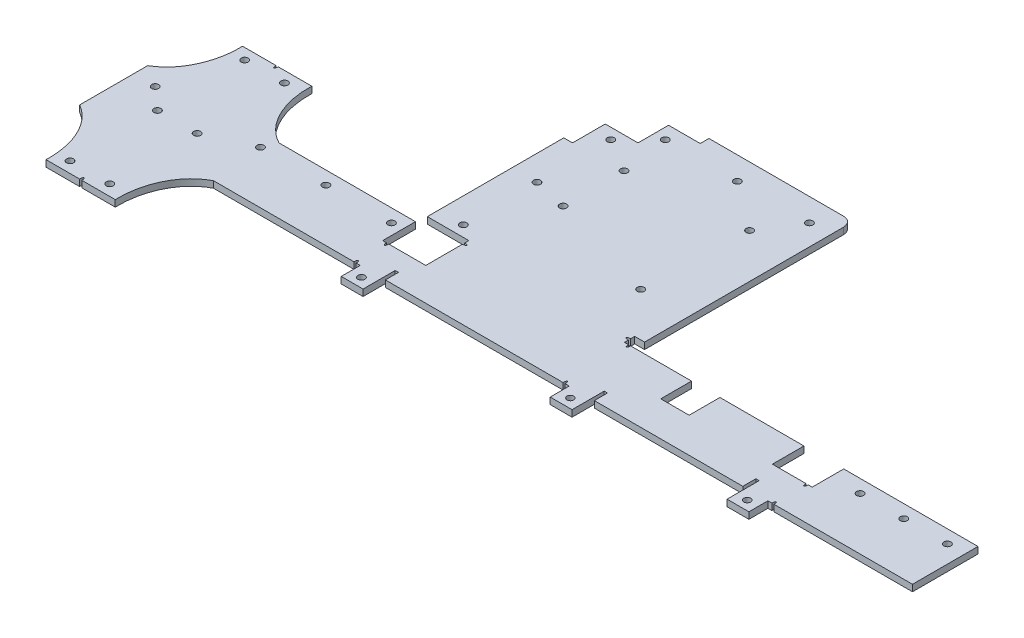
from build123d import *

# Parameters (mm, degrees)
SKETCH1_W                   = 100
SKETCH1_H                   = 100
BOSS_EXTRUDE1_DEPTH         = 30
BOSS_EXTRUDE3_DEPTH         = 30
CUT_EXTRUDE6_DEPTH          = 30
CUT_EXTRUDE7_DEPTH          = 30
CUT_EXTRUDE8_DEPTH          = 27
SHARPBEND4_START            = -30
SHARPBEND4_DEPTH            = 90
SHARPBEND4_START_2          = 3
SHARPBEND4_2_DEPTH          = 27
SHARPBEND4_3_DEPTH          = 90
EDGE_FLANGE1_DEPTH          = 91
SKETCH23_W                  = 14.447953321
SKETCH23_H                  = 15.392934238
CUT_EXTRUDE9_DEPTH          = 27
CUT_EXTRUDE10_START         = -4.5
CUT_EXTRUDE10_OUTLINE_W     = 19
CUT_EXTRUDE10_OUTLINE_H     = 14.446778047
CUT_EXTRUDE10_DEPTH         = 4.5
CUT_EXTRUDE11_START         = -4.5
CUT_EXTRUDE11_DEPTH         = 4.5
EDGE_FLANGE2_START          = 84
EDGE_FLANGE2_DEPTH          = 11.5
EDGE_FLANGE2_2_DEPTH        = 1.5
EDGE_FLANGE2_START_2        = 85.5
EDGE_FLANGE2_3_DEPTH        = 10
EDGE_FLANGE3_START          = 4.5
EDGE_FLANGE3_DEPTH          = 11.5
EDGE_FLANGE3_START_2        = 14.5
EDGE_FLANGE3_2_DEPTH        = 1.5
EDGE_FLANGE3_3_DEPTH        = 10
EDGE_FLANGE5_START          = 4.5
EDGE_FLANGE5_DEPTH          = 11.5
EDGE_FLANGE5_START_2        = 14.5
EDGE_FLANGE5_2_DEPTH        = 1.5
EDGE_FLANGE5_3_DEPTH        = 10
SKETCH44_R                  = 1.55
CUT_EXTRUDE12_DEPTH         = 3
SKETCH46_R                  = 1.6
CUT_EXTRUDE13_DEPTH         = 10
SKETCH47_R                  = 1.6
CUT_EXTRUDE14_DEPTH         = 10
SKETCH48_R                  = 1.6
CUT_EXTRUDE15_DEPTH         = 10
SKETCH49_R                  = 1.6
CUT_EXTRUDE16_DEPTH         = 10
SKETCH50_R                  = 1.6
CUT_EXTRUDE17_DEPTH         = 10
SKETCH51_R                  = 1.6
CUT_EXTRUDE18_DEPTH         = 10
SKETCH52_W                  = 13
SKETCH52_H                  = 11.5
CUT_EXTRUDE19_DEPTH         = 10
SKETCH59_W                  = 3
SKETCH59_H                  = 66
BOSS_EXTRUDE4_DEPTH         = 4
SKETCH56_W                  = 91.5
SKETCH56_H                  = 3
BOSS_EXTRUDE5_DEPTH         = 4.5
SKETCH53_W                  = 62.5
SKETCH53_H                  = 3
BOSS_EXTRUDE6_DEPTH         = 4
CUT_EXTRUDE21_DEPTH         = 10
CUT_EXTRUDE22_OUTLINE_R     = 1.6
CUT_EXTRUDE22_OUTLINE_R_2   = 1.55
CUT_EXTRUDE22_OUTLINE_W     = 13
CUT_EXTRUDE22_OUTLINE_H     = 11.5
CUT_EXTRUDE22_DEPTH         = 97
CUT_EXTRUDE22_START         = -2.5
CUT_EXTRUDE22_2_OUTLINE_W   = 62.5
CUT_EXTRUDE22_2_OUTLINE_H   = 3
CUT_EXTRUDE22_2_DEPTH       = 2.5
CUT_EXTRUDE22_START_2       = -3
CUT_EXTRUDE22_3_OUTLINE_R   = 1.6
CUT_EXTRUDE22_3_OUTLINE_R_2 = 1.55
CUT_EXTRUDE22_3_OUTLINE_W   = 10
CUT_EXTRUDE22_3_OUTLINE_H   = 3
CUT_EXTRUDE22_3_DEPTH       = 3
SKETCH68_RX                 = 1.5
SKETCH68_RY                 = 0.5
CUT_EXTRUDE23_DEPTH         = 10


with BuildPart() as part:
    # Sketch1 → Boss-Extrude1 (new body)
    with BuildSketch(Plane.XY):
        with Locations((50, 50)):
            Rectangle(SKETCH1_W, SKETCH1_H)
    extrude(amount=BOSS_EXTRUDE1_DEPTH)

    # Sketch5 → Boss-Extrude3 (add)
    with BuildSketch(Plane(origin=(0, 0, 0), x_dir=(-1, 0, 0), z_dir=(0, 0, -1))):
        Polygon((0, 33), (-3, 33), (-3, 3), (-33, 3), (-33, 0), (-3, 0), (0, 0), (0, 3), align=None)
    boss_extrude3 = extrude(amount=BOSS_EXTRUDE3_DEPTH)

    # Sketch9 → Cut-Extrude6 (cut)
    with BuildSketch(Plane(origin=(3, 0, 0), x_dir=(0, 0, -1), z_dir=(1, 0, 0))):
        with BuildLine():
            Line((30, 33), (30, 18))
            add(Edge.make_bspline(
                [(30, 18), (18.509534106, 17.590344289), (5.628092771, 22.225813209), (0, 33)],
                knots=[0, 0, 0, 0, 1, 1, 1, 1], degree=3))
            Line((0, 33), (30, 33))
        make_face()
    cut_extrude6 = extrude(amount=-CUT_EXTRUDE6_DEPTH, mode=Mode.SUBTRACT)

    # Sketch8 → Cut-Extrude7 (cut)
    with BuildSketch(Plane(origin=(0, 3, 0), x_dir=(1, 0, 0), z_dir=(0, 1, 0))):
        with BuildLine():
            Line((18, 30), (33, 30))
            Line((33, 30), (33, 0))
            add(Edge.make_bspline(
                [(18, 30), (17.590344289, 18.509534106), (22.225813209, 5.628092771), (33, 0)],
                knots=[0, 0, 0, 0, 1, 1, 1, 1], degree=3))
        make_face()
    cut_extrude7 = extrude(amount=-CUT_EXTRUDE7_DEPTH, mode=Mode.SUBTRACT)

    # Mirror2: Boss-Extrude3, Cut-Extrude6, Cut-Extrude7 across plane
    add(boss_extrude3.mirror(Plane(origin=(0, 0, 15), x_dir=(1, 0, 0), z_dir=(0, 0, -1))))
    add(cut_extrude6.mirror(Plane(origin=(0, 0, 15), x_dir=(1, 0, 0), z_dir=(0, 0, -1))), mode=Mode.SUBTRACT)
    add(cut_extrude7.mirror(Plane(origin=(0, 0, 15), x_dir=(1, 0, 0), z_dir=(0, 0, -1))), mode=Mode.SUBTRACT)

    # Sketch17 → Cut-Extrude8 (cut)
    with BuildSketch(Plane.XY.offset(30)):
        Polygon((3, 36), (3, 3), (36, 3), (97, 3), (97, 97), (3, 97), align=None)
    extrude(amount=-CUT_EXTRUDE8_DEPTH, mode=Mode.SUBTRACT)

    # SharpBend4: read off the stored shape, not the designer's step
    # SharpBend4 outline → SharpBend4 (cut)
    with BuildSketch(Plane.XY.offset(SHARPBEND4_START)):
        with BuildLine():
            Line((3, 95.5), (3, 34))
            Line((3, 34), (0, 34))
            Line((0, 34), (0, 32.000000005))
            Line((0, 32.000000005), (3, 32))
            Line((3, 32), (3, 4.5))
            ThreePointArc((3, 4.5), (3.439339828, 3.439339828), (4.5, 3))
            Line((4.5, 3), (95.5, 3))
            ThreePointArc((95.5, 3), (96.560660172, 3.439339828), (97, 4.5))
            Line((97, 4.5), (97, 95.5))
            ThreePointArc((97, 95.5), (96.560660172, 96.560660172), (95.5, 97))
            Line((95.5, 97), (4.5, 97))
            ThreePointArc((4.5, 97), (3.439339828, 96.560660172), (3, 95.5))
        make_face()
        with BuildLine():
            ThreePointArc((4.5, 0), (1.318019485, 1.318019485), (0, 4.5))
            Line((0, 4.5), (0, 0))
            Line((0, 0), (4.5, 0))
        make_face()
        with BuildLine():
            Line((0, 100), (0, 95.5))
            ThreePointArc((0, 95.5), (1.318019485, 98.681980515), (4.5, 100))
            Line((4.5, 100), (0, 100))
        make_face()
        with BuildLine():
            ThreePointArc((100, 4.5), (98.681980515, 1.318019485), (95.5, 0))
            Line((95.5, 0), (100, 0))
            Line((100, 0), (100, 4.5))
        make_face()
        with BuildLine():
            Line((100, 100), (95.5, 100))
            ThreePointArc((95.5, 100), (98.681980515, 98.681980515), (100, 95.5))
            Line((100, 95.5), (100, 100))
        make_face()
    extrude(amount=SHARPBEND4_DEPTH, mode=Mode.SUBTRACT)

    # SharpBend4 2 outline → SharpBend4 2 (add)
    with BuildSketch(Plane.XY.offset(SHARPBEND4_START_2)):
        with BuildLine():
            ThreePointArc((4.5, 3), (3.439339828, 3.439339828), (3, 4.5))
            Line((3, 4.5), (3, 3))
            Line((3, 3), (4.5, 3))
        make_face()
        with BuildLine():
            Line((3, 97), (3, 95.5))
            ThreePointArc((3, 95.5), (3.439339828, 96.560660172), (4.5, 97))
            Line((4.5, 97), (3, 97))
        make_face()
        with BuildLine():
            ThreePointArc((97, 4.5), (96.560660172, 3.439339828), (95.5, 3))
            Line((95.5, 3), (97, 3))
            Line((97, 3), (97, 4.5))
        make_face()
        with BuildLine():
            Line((97, 97), (95.5, 97))
            ThreePointArc((95.5, 97), (96.560660172, 96.560660172), (97, 95.5))
            Line((97, 95.5), (97, 97))
        make_face()
    extrude(amount=SHARPBEND4_2_DEPTH)

    # SharpBend4 3 outline → SharpBend4 3 (add)
    with BuildSketch(Plane.XY.offset(SHARPBEND4_START)):
        with BuildLine():
            ThreePointArc((4.5, 3), (3.439339828, 3.439339828), (3, 4.5))
            Line((3, 4.5), (3, 3))
            Line((3, 3), (4.5, 3))
        make_face()
    extrude(amount=SHARPBEND4_3_DEPTH)

    # Edge-Flange1: sheet metal written as solids
    # Edge-Flange1 section (on a plane across the edge) → Edge-Flange1 (add)
    with BuildSketch(Plane(origin=(97, 95.5, -1.5), x_dir=(0, 0, 1), z_dir=(0, -1, 0))):
        with BuildLine():
            Line((-3, 1.5), (-3, 93))
            Line((-3, 93), (0, 93))
            Line((0, 93), (0, 1.5))
            ThreePointArc((0, 1.5), (0.439339828, 0.439339828), (1.5, 0))
            Line((1.5, 0), (1.5, -3))
            ThreePointArc((1.5, -3), (-1.681980515, -1.681980515), (-3, 1.5))
        make_face()
    extrude(amount=EDGE_FLANGE1_DEPTH)

    # Sketch23 → Cut-Extrude9 (cut)
    with BuildSketch(Plane(origin=(0, 0, -4.5), x_dir=(-1, 0, 0), z_dir=(0, 0, -1))):
        with Locations((-10.77602334, 11.803532881)):
            Rectangle(SKETCH23_W, SKETCH23_H)
    extrude(amount=-CUT_EXTRUDE9_DEPTH, mode=Mode.SUBTRACT)

    # Cut-Extrude10: read off the stored shape, not the designer's step
    # Cut-Extrude10 outline → Cut-Extrude10 (cut)
    with BuildSketch(Plane(origin=(0, 100, 0), x_dir=(1, 0, 0), z_dir=(0, 1, 0)).offset(CUT_EXTRUDE10_START)):
        with Locations((8.5, -7.223389024)):
            Rectangle(CUT_EXTRUDE10_OUTLINE_W, CUT_EXTRUDE10_OUTLINE_H)
    extrude(amount=CUT_EXTRUDE10_DEPTH, mode=Mode.SUBTRACT)

    # Cut-Extrude11: read off the stored shape, not the designer's step
    # Cut-Extrude11 outline → Cut-Extrude11 (cut)
    with BuildSketch(Plane(origin=(100, 0, 0), x_dir=(0, 0, -1), z_dir=(1, 0, 0)).offset(CUT_EXTRUDE11_START)):
        Polygon((6, 19.5), (-15, 19.5), (-15, -1), (0, -1), (0, 4.5), (6, 4.5), align=None)
    extrude(amount=CUT_EXTRUDE11_DEPTH, mode=Mode.SUBTRACT)

    # Edge-Flange2: read off the stored shape, not the designer's step
    # Edge-Flange2 outline → Edge-Flange2 (cut)
    with BuildSketch(Plane.YZ.offset(EDGE_FLANGE2_START)):
        with BuildLine():
            Line((97, 30), (97, 29.742640687))
            ThreePointArc((97, 29.742640687), (99.174234614, 28.098076211), (100, 25.5))
            Line((100, 25.5), (100, 30))
            Line((100, 30), (97, 30))
        make_face()
    extrude(amount=EDGE_FLANGE2_DEPTH, mode=Mode.SUBTRACT)

    # Edge-Flange2 2 outline → Edge-Flange2 2 (cut)
    with BuildSketch(Plane.YZ.offset(EDGE_FLANGE2_START)):
        with BuildLine():
            ThreePointArc((100, 25.5), (99.174234614, 28.098076211), (97, 29.742640687))
            Line((97, 29.742640687), (97, 24))
            Line((97, 24), (100, 24))
            Line((100, 24), (100, 25.5))
        make_face()
    extrude(amount=EDGE_FLANGE2_2_DEPTH, mode=Mode.SUBTRACT)

    # Edge-Flange2 3 outline → Edge-Flange2 3 (add)
    with BuildSketch(Plane.YZ.offset(EDGE_FLANGE2_START_2)):
        with BuildLine():
            Line((95.5, 30), (87, 30))
            Line((87, 30), (87, 27))
            Line((87, 27), (95.5, 27))
            ThreePointArc((95.5, 27), (96.560660172, 26.560660172), (97, 25.5))
            Line((97, 25.5), (97, 29.742640687))
            ThreePointArc((97, 29.742640687), (96.260958904, 29.935193518), (95.5, 30))
        make_face()
    extrude(amount=EDGE_FLANGE2_3_DEPTH)

    # Edge-Flange3: read off the stored shape, not the designer's step
    # Edge-Flange3 outline → Edge-Flange3 (cut)
    with BuildSketch(Plane(origin=(0, 0, 0), x_dir=(1, 0, 0), z_dir=(0, 1, 0)).offset(EDGE_FLANGE3_START)):
        with BuildLine():
            ThreePointArc((100, -25.5), (99.174234614, -28.098076211), (97, -29.742640687))
            Line((97, -29.742640687), (97, -30))
            Line((97, -30), (100, -30))
            Line((100, -30), (100, -25.5))
        make_face()
    extrude(amount=EDGE_FLANGE3_DEPTH, mode=Mode.SUBTRACT)

    # Edge-Flange3 2 outline → Edge-Flange3 2 (cut)
    with BuildSketch(Plane(origin=(0, 0, 0), x_dir=(1, 0, 0), z_dir=(0, 1, 0)).offset(EDGE_FLANGE3_START_2)):
        with BuildLine():
            Line((97, -24), (97, -29.742640687))
            ThreePointArc((97, -29.742640687), (99.174234614, -28.098076211), (100, -25.5))
            Line((100, -25.5), (100, -24))
            Line((100, -24), (97, -24))
        make_face()
    extrude(amount=EDGE_FLANGE3_2_DEPTH, mode=Mode.SUBTRACT)

    # Edge-Flange3 3 outline → Edge-Flange3 3 (add)
    with BuildSketch(Plane(origin=(0, 0, 0), x_dir=(1, 0, 0), z_dir=(0, 1, 0)).offset(EDGE_FLANGE3_START)):
        with BuildLine():
            Line((87, -30), (95.5, -30))
            ThreePointArc((95.5, -30), (96.260958904, -29.935193518), (97, -29.742640687))
            Line((97, -29.742640687), (97, -25.5))
            ThreePointArc((97, -25.5), (96.560660172, -26.560660172), (95.5, -27))
            Line((95.5, -27), (87, -27))
            Line((87, -27), (87, -30))
        make_face()
    extrude(amount=EDGE_FLANGE3_3_DEPTH)

    # Edge-Flange5: read off the stored shape, not the designer's step
    # Edge-Flange5 outline → Edge-Flange5 (cut)
    with BuildSketch(Plane.YZ.offset(EDGE_FLANGE5_START)):
        with BuildLine():
            Line((97, 30), (97, 29.742640687))
            ThreePointArc((97, 29.742640687), (99.174234614, 28.098076211), (100, 25.5))
            Line((100, 25.5), (100, 30))
            Line((100, 30), (97, 30))
        make_face()
    extrude(amount=EDGE_FLANGE5_DEPTH, mode=Mode.SUBTRACT)

    # Edge-Flange5 2 outline → Edge-Flange5 2 (cut)
    with BuildSketch(Plane.YZ.offset(EDGE_FLANGE5_START_2)):
        with BuildLine():
            ThreePointArc((100, 25.5), (99.174234614, 28.098076211), (97, 29.742640687))
            Line((97, 29.742640687), (97, 24))
            Line((97, 24), (100, 24))
            Line((100, 24), (100, 25.5))
        make_face()
    extrude(amount=EDGE_FLANGE5_2_DEPTH, mode=Mode.SUBTRACT)

    # Edge-Flange5 3 outline → Edge-Flange5 3 (add)
    with BuildSketch(Plane.YZ.offset(EDGE_FLANGE5_START)):
        with BuildLine():
            Line((95.5, 30), (87, 30))
            Line((87, 30), (87, 27))
            Line((87, 27), (95.5, 27))
            ThreePointArc((95.5, 27), (96.560660172, 26.560660172), (97, 25.5))
            Line((97, 25.5), (97, 29.742640687))
            ThreePointArc((97, 29.742640687), (96.260958904, 29.935193518), (95.5, 30))
        make_face()
    extrude(amount=EDGE_FLANGE5_3_DEPTH)

    # Sketch44 → Cut-Extrude12 (cut)
    with BuildSketch(Plane.XY.offset(30)):
        with Locations((72.259236291, 9.492809358)):
            Circle(SKETCH44_R)
        with Locations((90.5, 91.25)):
            Circle(SKETCH44_R)
        with Locations((9.5, 91.25)):
            Circle(SKETCH44_R)
    extrude(amount=-CUT_EXTRUDE12_DEPTH, mode=Mode.SUBTRACT)

    # Sketch46 → Cut-Extrude13 (cut)
    with BuildSketch(Plane.ZY):
        with Locations((-25, 12)):
            Circle(SKETCH46_R)
        with Locations((15, 12)):
            Circle(SKETCH46_R)
        with Locations((55, 12)):
            Circle(SKETCH46_R)
    extrude(amount=-CUT_EXTRUDE13_DEPTH, mode=Mode.SUBTRACT)

    # Sketch47 → Cut-Extrude14 (cut)
    with BuildSketch(Plane.ZY):
        with Locations((6, 22.00000001)):
            Circle(SKETCH47_R)
        with Locations((6, 42.00000001)):
            Circle(SKETCH47_R)
        with Locations((6, 62.00000001)):
            Circle(SKETCH47_R)
        with Locations((6, 82.00000001)):
            Circle(SKETCH47_R)
    extrude(amount=-CUT_EXTRUDE14_DEPTH, mode=Mode.SUBTRACT)

    # Sketch48 → Cut-Extrude15 (cut)
    with BuildSketch(Plane(origin=(0, 0, -4.5), x_dir=(-1, 0, 0), z_dir=(0, 0, -1))):
        with Locations((-10.5, 90.5)):
            Circle(SKETCH48_R)
        with Locations((-10.5, 57.5)):
            Circle(SKETCH48_R)
        with Locations((-10.5, 24.5)):
            Circle(SKETCH48_R)
        with Locations((-90.5, 12)):
            Circle(SKETCH48_R)
        with Locations((-23, 12)):
            Circle(SKETCH48_R)
        with Locations((-56.75, 12)):
            Circle(SKETCH48_R)
    extrude(amount=-CUT_EXTRUDE15_DEPTH, mode=Mode.SUBTRACT)

    # Sketch49 → Cut-Extrude16 (cut)
    with BuildSketch(Plane.XZ):
        with Locations(Location((10.5, -25, 0), (0, 0, 270))):
            Circle(SKETCH49_R)
        with Locations(Location((10.5, 15, 0), (0, 0, 270))):
            Circle(SKETCH49_R)
        with Locations(Location((10.5, 55, 0), (0, 0, 270))):
            Circle(SKETCH49_R)
        with Locations(Location((90.5, 6, 0), (0, 0, 270))):
            Circle(SKETCH49_R)
        with Locations(Location((60.5, 6, 0), (0, 0, 270))):
            Circle(SKETCH49_R)
        with Locations(Location((30.5, 6, 0), (0, 0, 270))):
            Circle(SKETCH49_R)
    extrude(amount=-CUT_EXTRUDE16_DEPTH, mode=Mode.SUBTRACT)

    # Sketch50 → Cut-Extrude17 (cut)
    with BuildSketch(Plane.XY.offset(30)):
        with Locations((91.25, 9.5)):
            Circle(SKETCH50_R)
    extrude(amount=-CUT_EXTRUDE17_DEPTH, mode=Mode.SUBTRACT)

    # Sketch51 → Cut-Extrude18 (cut)
    with BuildSketch(Plane.XY.offset(-1.5)):
        with Locations((75.48613187, 78.2)):
            Circle(SKETCH51_R)
        with Locations((27.18613187, 79.8)):
            Circle(SKETCH51_R)
        with Locations((32.28613187, 27.4)):
            Circle(SKETCH51_R)
        with Locations((60.18613187, 27.4)):
            Circle(SKETCH51_R)
    extrude(amount=-CUT_EXTRUDE18_DEPTH, mode=Mode.SUBTRACT)

    # Sketch52 → Cut-Extrude19 (cut)
    with BuildSketch(Plane(origin=(0, 100, 0), x_dir=(1, 0, 0), z_dir=(0, 1, 0))):
        with Locations((62.98613187, -8.35)):
            Rectangle(SKETCH52_W, SKETCH52_H)
    extrude(amount=-CUT_EXTRUDE19_DEPTH, mode=Mode.SUBTRACT)

    # Sketch59 → Boss-Extrude4 (add)
    with BuildSketch(Plane.ZY.offset(-4)):
        with Locations((-3, 67)):
            Rectangle(SKETCH59_W, SKETCH59_H)
    extrude(amount=BOSS_EXTRUDE4_DEPTH)

    # Sketch56 → Boss-Extrude5 (add)
    with BuildSketch(Plane(origin=(0, 95.5, 0), x_dir=(1, 0, 0), z_dir=(0, 1, 0))):
        with Locations((49.75, 3)):
            Rectangle(SKETCH56_W, SKETCH56_H)
    extrude(amount=BOSS_EXTRUDE5_DEPTH)

    # Sketch53 → Boss-Extrude6 (add)
    with BuildSketch(Plane.XZ.offset(-4.5)):
        with Locations((64.25, -3)):
            Rectangle(SKETCH53_W, SKETCH53_H)
    extrude(amount=BOSS_EXTRUDE6_DEPTH)

    # Sketch66 → Cut-Extrude21 (cut)
    with BuildSketch(Plane.XY.offset(-1.5)):
        with BuildLine():
            Line((0, 95.5), (-1.773907689, 95.213782635))
            Line((-1.773907689, 95.213782635), (-1.443976946, 101.658429812))
            Line((-1.443976946, 101.658429812), (4.813709476, 100.624646817))
            Line((4.813709476, 100.624646817), (4.5, 100))
            add(Edge.make_bspline(
                [(4.5, 100), (0.2021075, 99.637534611), (0, 95.5)],
                knots=[0, 0, 0, 1, 1, 1], degree=2))
        make_face()
    extrude(amount=-CUT_EXTRUDE21_DEPTH, mode=Mode.SUBTRACT)

    # Cut-Extrude22: read off the stored shape, not the designer's step
    # Cut-Extrude22 outline → Cut-Extrude22 (cut)
    with BuildSketch(Plane(origin=(0, 3, 0), x_dir=(1, 0, 0), z_dir=(0, 1, 0))):
        with BuildLine():
            Line((221.938646091, 0), (191.21238898, 0))
            Line((191.21238898, 0), (191.21238898, 4.71238898))
            Line((191.21238898, 4.71238898), (195.71238898, 4.71238898))
            Line((195.71238898, 4.71238898), (195.71238898, 95.71238898))
            add(Edge.make_bspline(
                [(191.21238898, 100.21238898), (195.349923592, 100.01028148), (195.71238898, 95.71238898)],
                knots=[0, 0, 0, 1, 1, 1], degree=2))
            Line((191.21238898, 100.21238898), (129.71238898, 100.21238898))
            Line((129.71238898, 100.21238898), (129.71238898, 96.21238898))
            Line((129.71238898, 96.21238898), (115.21238898, 96.21238898))
            Line((115.21238898, 96.21238898), (115.21238898, 82.21238898))
            Line((115.21238898, 82.21238898), (100.21238898, 82.21238898))
            Line((100.21238898, 82.21238898), (100.21238898, 67.21238898))
            Line((100.21238898, 67.21238898), (96.21238898, 67.21238898))
            Line((96.21238898, 67.21238898), (96.21238898, 4.71238898))
            Line((96.21238898, 4.71238898), (115.21238898, 4.71238898))
            Line((115.21238898, 4.71238898), (115.21238898, -15))
            Line((115.21238898, -15), (100, -15))
            Line((100, -15), (100, 0))
            ThreePointArc((100, 0), (98.681980515, 3.181980515), (95.5, 4.5))
            Line((95.5, 4.5), (26.940295931, 4.5))
            add(Edge.make_bspline(
                [(18, 30), (17.677600176, 20.956981476), (20.48000926, 11.052431718), (26.940295931, 4.5)],
                knots=[0, 0, 0, 0, 0.787001903, 0.787001903, 0.787001903, 0.787001903], degree=3))
            Line((18, 30), (-13.71238898, 30))
            add(Edge.make_bspline(
                [(-27.71238899, 0.553221953), (-17.651151096, 6.438308121), (-13.315638457, 18.871512756), (-13.71238898, 30)],
                knots=[0.031502522, 0.031502522, 0.031502522, 0.031502522, 1, 1, 1, 1], degree=3))
            Line((-27.71238899, 0.553221953), (-27.71238899, -30.553221953))
            add(Edge.make_bspline(
                [(-27.71238899, -30.553221953), (-17.651151096, -36.438308121), (-13.315638457, -48.871512756), (-13.71238898, -60)],
                knots=[0.031502522, 0.031502522, 0.031502522, 0.031502522, 1, 1, 1, 1], degree=3))
            Line((-13.71238898, -60), (18, -60))
            add(Edge.make_bspline(
                [(18, -60), (17.590344289, -48.509534106), (22.225813209, -35.628092771), (33, -30)],
                knots=[0, 0, 0, 0, 1, 1, 1, 1], degree=3))
            Line((33, -30), (100.21238898, -30))
            Line((100.21238898, -30), (100.21238898, -38.71238898))
            Line((100.21238898, -38.71238898), (110.21238898, -38.71238898))
            Line((110.21238898, -38.71238898), (110.21238898, -24))
            Line((110.21238898, -24), (111.71238898, -24))
            Line((111.71238898, -24), (111.71238898, -30))
            Line((111.71238898, -30), (195.924777961, -30))
            Line((195.924777961, -30), (195.924777961, -38.71238898))
            Line((195.924777961, -38.71238898), (205.924777961, -38.71238898))
            Line((205.924777961, -38.71238898), (205.924777961, -24))
            Line((205.924777961, -24), (207.424777961, -24))
            Line((207.424777961, -24), (207.424777961, -30))
            Line((207.424777961, -30), (275.424777961, -30))
            Line((275.424777961, -30), (275.424777961, -24))
            Line((275.424777961, -24), (276.924777961, -24))
            Line((276.924777961, -24), (276.924777961, -38.71238898))
            Line((276.924777961, -38.71238898), (286.924777961, -38.71238898))
            Line((286.924777961, -38.71238898), (286.924777961, -30))
            Line((286.924777961, -30), (353.137166941, -30))
            Line((353.137166941, -30), (353.137166941, 0))
            Line((353.137166941, 0), (291.637166941, 0))
            Line((291.637166941, 0), (291.637166941, -14.446778047))
            Line((291.637166941, -14.446778047), (273.424777961, -14.446778047))
            Line((273.424777961, -14.446778047), (273.424777961, 0))
            Line((273.424777961, 0), (234.938646091, 0))
            Line((234.938646091, 0), (234.938646091, -14.1))
            Line((234.938646091, -14.1), (221.938646091, -14.1))
            Line((221.938646091, -14.1), (221.938646091, 0))
        make_face()
        with Locations((105.21238898, -34.46238898)):
            Circle(CUT_EXTRUDE22_OUTLINE_R, mode=Mode.SUBTRACT)
        with Locations((107.71238898, 9.71238898)):
            Circle(CUT_EXTRUDE22_OUTLINE_R, mode=Mode.SUBTRACT)
        with Locations((200.924777961, -34.46238898)):
            Circle(CUT_EXTRUDE22_OUTLINE_R_2, mode=Mode.SUBTRACT)
        with Locations((281.924777961, -34.46238898)):
            Circle(CUT_EXTRUDE22_OUTLINE_R_2, mode=Mode.SUBTRACT)
        with Locations((305.137166931, -6)):
            Circle(CUT_EXTRUDE22_OUTLINE_R, mode=Mode.SUBTRACT)
        with Locations((325.137166931, -6)):
            Circle(CUT_EXTRUDE22_OUTLINE_R, mode=Mode.SUBTRACT)
        with Locations((345.137166931, -6)):
            Circle(CUT_EXTRUDE22_OUTLINE_R, mode=Mode.SUBTRACT)
        with Locations((123.11238898, 40.026257111)):
            Circle(CUT_EXTRUDE22_OUTLINE_R, mode=Mode.SUBTRACT)
        with Locations((107.71238898, 43.46238898)):
            Circle(CUT_EXTRUDE22_OUTLINE_R, mode=Mode.SUBTRACT)
        with Locations((107.71238898, 77.21238898)):
            Circle(CUT_EXTRUDE22_OUTLINE_R, mode=Mode.SUBTRACT)
        with Locations((123.11238898, 67.926257111)):
            Circle(CUT_EXTRUDE22_OUTLINE_R, mode=Mode.SUBTRACT)
        with Locations((120.21238898, 89.71238898)):
            Circle(CUT_EXTRUDE22_OUTLINE_R, mode=Mode.SUBTRACT)
        with Locations((153.21238898, 89.71238898)):
            Circle(CUT_EXTRUDE22_OUTLINE_R, mode=Mode.SUBTRACT)
        with Locations((173.91238898, 24.726257111)):
            Circle(CUT_EXTRUDE22_OUTLINE_R, mode=Mode.SUBTRACT)
        with Locations((175.51238898, 73.026257111)):
            Circle(CUT_EXTRUDE22_OUTLINE_R, mode=Mode.SUBTRACT)
        with Locations((186.21238898, 89.71238898)):
            Circle(CUT_EXTRUDE22_OUTLINE_R, mode=Mode.SUBTRACT)
        with Locations((62.98613187, -8.35)):
            Rectangle(CUT_EXTRUDE22_OUTLINE_W, CUT_EXTRUDE22_OUTLINE_H, mode=Mode.SUBTRACT)
        with Locations((-17.71238899, -6)):
            Circle(CUT_EXTRUDE22_OUTLINE_R, mode=Mode.SUBTRACT)
        with BuildLine():
            Line((12.001314581, -14.446778047), (8.998685419, -14.446778047))
            ThreePointArc((8.998685419, -14.446778047), (10.5, -13.4), (12.001314581, -14.446778047))
        make_face(mode=Mode.SUBTRACT)
        with Locations((-7.71238898, 25)):
            Circle(CUT_EXTRUDE22_OUTLINE_R, mode=Mode.SUBTRACT)
        with Locations((10.5, 25)):
            Circle(CUT_EXTRUDE22_OUTLINE_R, mode=Mode.SUBTRACT)
        with Locations((-7.71238898, -55)):
            Circle(CUT_EXTRUDE22_OUTLINE_R, mode=Mode.SUBTRACT)
        with Locations((10.5, -55)):
            Circle(CUT_EXTRUDE22_OUTLINE_R, mode=Mode.SUBTRACT)
        with Locations((-7.71238898, -15)):
            Circle(CUT_EXTRUDE22_OUTLINE_R, mode=Mode.SUBTRACT)
    extrude(amount=CUT_EXTRUDE22_DEPTH, mode=Mode.SUBTRACT)

    # Cut-Extrude22 2 outline → Cut-Extrude22 2 (cut)
    with BuildSketch(Plane(origin=(0, 3, 0), x_dir=(1, 0, 0), z_dir=(0, 1, 0)).offset(CUT_EXTRUDE22_START)):
        with Locations((64.25, 3)):
            Rectangle(CUT_EXTRUDE22_2_OUTLINE_W, CUT_EXTRUDE22_2_OUTLINE_H)
    extrude(amount=CUT_EXTRUDE22_2_DEPTH, mode=Mode.SUBTRACT)

    # Cut-Extrude22 3 outline → Cut-Extrude22 3 (add)
    # profile 1 of 2: a face of its own
    with BuildSketch(Plane(origin=(0, 3, 0), x_dir=(1, 0, 0), z_dir=(0, 1, 0)).offset(CUT_EXTRUDE22_START_2)):
        with BuildLine():
            Line((221.938646091, 0), (191.21238898, 0))
            Line((191.21238898, 0), (191.21238898, 4.71238898))
            Line((191.21238898, 4.71238898), (195.71238898, 4.71238898))
            Line((195.71238898, 4.71238898), (195.71238898, 95.71238898))
            add(Edge.make_bspline(
                [(191.21238898, 100.21238898), (195.349923592, 100.01028148), (195.71238898, 95.71238898)],
                knots=[0, 0, 0, 1, 1, 1], degree=2))
            Line((191.21238898, 100.21238898), (129.71238898, 100.21238898))
            Line((129.71238898, 100.21238898), (129.71238898, 96.21238898))
            Line((129.71238898, 96.21238898), (115.21238898, 96.21238898))
            Line((115.21238898, 96.21238898), (115.21238898, 82.21238898))
            Line((115.21238898, 82.21238898), (100.21238898, 82.21238898))
            Line((100.21238898, 82.21238898), (100.21238898, 67.21238898))
            Line((100.21238898, 67.21238898), (96.21238898, 67.21238898))
            Line((96.21238898, 67.21238898), (96.21238898, 4.71238898))
            Line((96.21238898, 4.71238898), (115.21238898, 4.71238898))
            Line((115.21238898, 4.71238898), (115.21238898, -15))
            Line((115.21238898, -15), (95.5, -15))
            Line((95.5, -15), (95.5, -25.5))
            Line((95.5, -25.5), (85.5, -25.5))
            Line((85.5, -25.5), (85.5, -24))
            Line((85.5, -24), (84, -24))
            Line((84, -24), (84, -30))
            Line((84, -30), (85.5, -30))
            Line((85.5, -30), (85.5, -27))
            Line((85.5, -27), (95.5, -27))
            Line((95.5, -27), (95.5, -30))
            Line((95.5, -30), (100.21238898, -30))
            Line((100.21238898, -30), (100.21238898, -38.71238898))
            Line((100.21238898, -38.71238898), (110.21238898, -38.71238898))
            Line((110.21238898, -38.71238898), (110.21238898, -24))
            Line((110.21238898, -24), (111.71238898, -24))
            Line((111.71238898, -24), (111.71238898, -30))
            Line((111.71238898, -30), (195.924777961, -30))
            Line((195.924777961, -30), (195.924777961, -38.71238898))
            Line((195.924777961, -38.71238898), (205.924777961, -38.71238898))
            Line((205.924777961, -38.71238898), (205.924777961, -24))
            Line((205.924777961, -24), (207.424777961, -24))
            Line((207.424777961, -24), (207.424777961, -30))
            Line((207.424777961, -30), (275.424777961, -30))
            Line((275.424777961, -30), (275.424777961, -24))
            Line((275.424777961, -24), (276.924777961, -24))
            Line((276.924777961, -24), (276.924777961, -38.71238898))
            Line((276.924777961, -38.71238898), (286.924777961, -38.71238898))
            Line((286.924777961, -38.71238898), (286.924777961, -30))
            Line((286.924777961, -30), (353.137166941, -30))
            Line((353.137166941, -30), (353.137166941, 0))
            Line((353.137166941, 0), (291.637166941, 0))
            Line((291.637166941, 0), (291.637166941, -14.446778047))
            Line((291.637166941, -14.446778047), (273.424777961, -14.446778047))
            Line((273.424777961, -14.446778047), (273.424777961, 0))
            Line((273.424777961, 0), (234.938646091, 0))
            Line((234.938646091, 0), (234.938646091, -14.1))
            Line((234.938646091, -14.1), (221.938646091, -14.1))
            Line((221.938646091, -14.1), (221.938646091, 0))
        make_face()
        with Locations((105.21238898, -34.46238898)):
            Circle(CUT_EXTRUDE22_3_OUTLINE_R, mode=Mode.SUBTRACT)
        with Locations((107.71238898, 9.71238898)):
            Circle(CUT_EXTRUDE22_3_OUTLINE_R, mode=Mode.SUBTRACT)
        with Locations((200.924777961, -34.46238898)):
            Circle(CUT_EXTRUDE22_3_OUTLINE_R_2, mode=Mode.SUBTRACT)
        with Locations((281.924777961, -34.46238898)):
            Circle(CUT_EXTRUDE22_3_OUTLINE_R_2, mode=Mode.SUBTRACT)
        with Locations((305.137166931, -6)):
            Circle(CUT_EXTRUDE22_3_OUTLINE_R, mode=Mode.SUBTRACT)
        with Locations((325.137166931, -6)):
            Circle(CUT_EXTRUDE22_3_OUTLINE_R, mode=Mode.SUBTRACT)
        with Locations((345.137166931, -6)):
            Circle(CUT_EXTRUDE22_3_OUTLINE_R, mode=Mode.SUBTRACT)
        with Locations((123.11238898, 40.026257111)):
            Circle(CUT_EXTRUDE22_3_OUTLINE_R, mode=Mode.SUBTRACT)
        with Locations((107.71238898, 43.46238898)):
            Circle(CUT_EXTRUDE22_3_OUTLINE_R, mode=Mode.SUBTRACT)
        with Locations((107.71238898, 77.21238898)):
            Circle(CUT_EXTRUDE22_3_OUTLINE_R, mode=Mode.SUBTRACT)
        with Locations((123.11238898, 67.926257111)):
            Circle(CUT_EXTRUDE22_3_OUTLINE_R, mode=Mode.SUBTRACT)
        with Locations((120.21238898, 89.71238898)):
            Circle(CUT_EXTRUDE22_3_OUTLINE_R, mode=Mode.SUBTRACT)
        with Locations((153.21238898, 89.71238898)):
            Circle(CUT_EXTRUDE22_3_OUTLINE_R, mode=Mode.SUBTRACT)
        with Locations((173.91238898, 24.726257111)):
            Circle(CUT_EXTRUDE22_3_OUTLINE_R, mode=Mode.SUBTRACT)
        with Locations((175.51238898, 73.026257111)):
            Circle(CUT_EXTRUDE22_3_OUTLINE_R, mode=Mode.SUBTRACT)
        with Locations((186.21238898, 89.71238898)):
            Circle(CUT_EXTRUDE22_3_OUTLINE_R, mode=Mode.SUBTRACT)
    # profile 2 of 2: a face of its own
    with BuildSketch(Plane(origin=(0, 3, 0), x_dir=(1, 0, 0), z_dir=(0, 1, 0)).offset(CUT_EXTRUDE22_START_2)):
        with BuildLine():
            Line((18, 0), (33, 0))
            add(Edge.make_bspline(
                [(30.510537957, 1.5), (31.300750439, 0.955777257), (32.130379443, 0.454262142), (33, 0)],
                knots=[0.919286664, 0.919286664, 0.919286664, 0.919286664, 1, 1, 1, 1], degree=3))
            Line((30.510537957, 1.5), (4.5, 1.5))
            Line((4.5, 1.5), (4.5, 4.5))
            Line((4.5, 4.5), (26.940295931, 4.5))
            add(Edge.make_bspline(
                [(18, 30), (17.677600176, 20.956981476), (20.48000926, 11.052431718), (26.940295931, 4.5)],
                knots=[0, 0, 0, 0, 0.787001903, 0.787001903, 0.787001903, 0.787001903], degree=3))
            Line((18, 30), (-13.71238898, 30))
            add(Edge.make_bspline(
                [(-27.71238899, 0.553221953), (-17.651151096, 6.438308121), (-13.315638457, 18.871512756), (-13.71238898, 30)],
                knots=[0.031502522, 0.031502522, 0.031502522, 0.031502522, 1, 1, 1, 1], degree=3))
            Line((-27.71238899, 0.553221953), (-27.71238899, -30.553221953))
            add(Edge.make_bspline(
                [(-27.71238899, -30.553221953), (-17.651151096, -36.438308121), (-13.315638457, -48.871512756), (-13.71238898, -60)],
                knots=[0.031502522, 0.031502522, 0.031502522, 0.031502522, 1, 1, 1, 1], degree=3))
            Line((-13.71238898, -60), (18, -60))
            add(Edge.make_bspline(
                [(18, -60), (17.590344289, -48.509534106), (22.225813209, -35.628092771), (33, -30)],
                knots=[0, 0, 0, 0, 1, 1, 1, 1], degree=3))
            Line((33, -30), (16, -30))
            Line((16, -30), (16, -24))
            Line((16, -24), (14.5, -24))
            Line((14.5, -24), (14.5, -25.5))
            Line((14.5, -25.5), (4.5, -25.5))
            Line((4.5, -25.5), (4.5, -14.446778047))
            Line((4.5, -14.446778047), (8.998685419, -14.446778047))
            ThreePointArc((8.998685419, -14.446778047), (10.5, -13.4), (12.001314581, -14.446778047))
            Line((12.001314581, -14.446778047), (18, -14.446778047))
            Line((18, -14.446778047), (18, 0))
        make_face()
        with Locations((-7.71238898, -55)):
            Circle(CUT_EXTRUDE22_3_OUTLINE_R, mode=Mode.SUBTRACT)
        with Locations((10.5, -55)):
            Circle(CUT_EXTRUDE22_3_OUTLINE_R, mode=Mode.SUBTRACT)
        with Locations((9.5, -28.5)):
            Rectangle(CUT_EXTRUDE22_3_OUTLINE_W, CUT_EXTRUDE22_3_OUTLINE_H, mode=Mode.SUBTRACT)
        with Locations((-7.71238898, -15)):
            Circle(CUT_EXTRUDE22_3_OUTLINE_R, mode=Mode.SUBTRACT)
        with Locations((-17.71238899, -6)):
            Circle(CUT_EXTRUDE22_3_OUTLINE_R, mode=Mode.SUBTRACT)
        with Locations((-7.71238898, 25)):
            Circle(CUT_EXTRUDE22_3_OUTLINE_R, mode=Mode.SUBTRACT)
        with Locations((10.5, 25)):
            Circle(CUT_EXTRUDE22_3_OUTLINE_R, mode=Mode.SUBTRACT)
    extrude(amount=CUT_EXTRUDE22_3_DEPTH)

    # Sketch68 → Cut-Extrude23 (cut)
    with BuildSketch(Plane(origin=(0, 3, 0), x_dir=(1, 0, 0), z_dir=(0, 1, 0))):
        with Locations(Location((2.14380551, 30), (0, 0, 90))):
            Ellipse(SKETCH68_RX, SKETCH68_RY)
        with Locations((115.21238898, 2.35619449)):
            Ellipse(SKETCH68_RX, SKETCH68_RY)
        with Locations(Location((2.171911188, -59.967494779), (0, 0, 90))):
            Ellipse(SKETCH68_RX, SKETCH68_RY)
        with Locations(Location((289.313395592, -14.462809415), (0, 0, 90))):
            Ellipse(SKETCH68_RX, SKETCH68_RY)
        with Locations(Location((289.24527366, -29.994609724), (0, 0, 90))):
            Ellipse(SKETCH68_RX, SKETCH68_RY)
        with Locations(Location((193.567688314, -29.968599926), (0, 0, 90))):
            Ellipse(SKETCH68_RX, SKETCH68_RY)
        with Locations(Location((193.545015453, 0.026573752), (0, 0, 90))):
            Ellipse(SKETCH68_RX, SKETCH68_RY)
        with Locations(Location((97.775324463, -14.975487946), (0, 0, 90))):
            Ellipse(SKETCH68_RX, SKETCH68_RY)
        with Locations(Location((97.812598204, -29.996805644), (0, 0, 90))):
            Ellipse(SKETCH68_RX, SKETCH68_RY)
        with Locations((191.207684176, 2.324602944)):
            Ellipse(SKETCH68_RX, SKETCH68_RY)
    extrude(amount=-CUT_EXTRUDE23_DEPTH, mode=Mode.SUBTRACT)


solid = part.part
